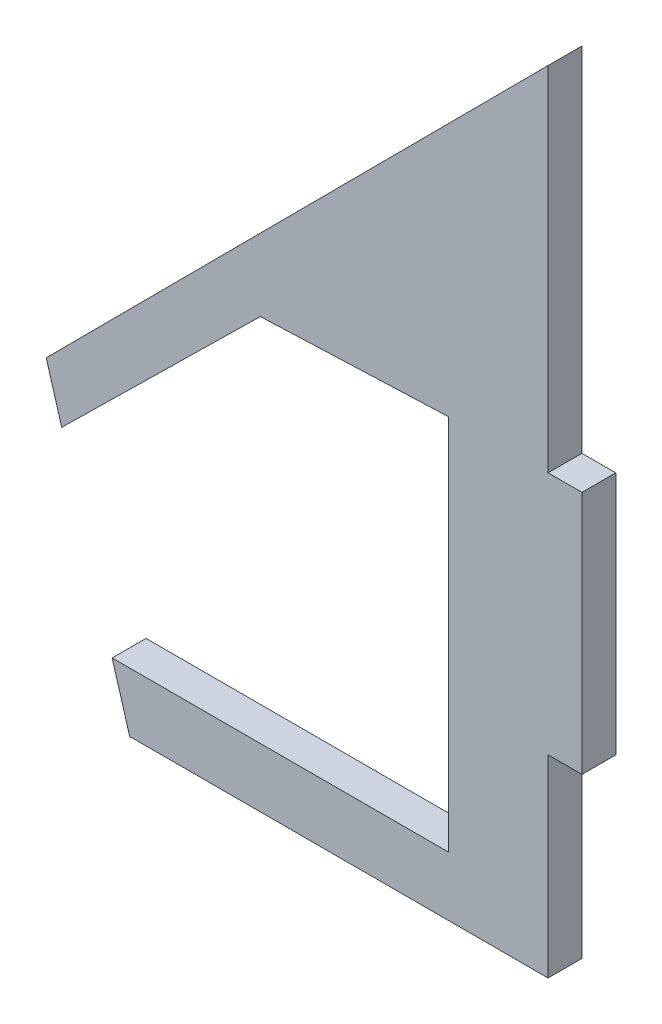
from build123d import *

# Parameters (mm, degrees)
BOSS_EXTRUDE1_DEPTH = 1.524


with BuildPart() as part:
    # Sketch1 → Boss-Extrude1 (new body)
    with BuildSketch(Plane.XY):
        Polygon((-0.895219037, 31.645019131), (-0.895219037, 47.520517489), (-23.482745214, 24.835129324), (-22.785515157, 22.473336945), (-13.845756763, 31.26033865), (-5.376702604, 31.593513777), (-5.376702604, 14.620779626), (-20.514575792, 14.620779626), (-19.727451889, 11.954481441), (-0.895219037, 11.954481441), (-0.895219037, 20.651359585), (0.628780963, 20.651359585), (0.628780963, 31.645019131), align=None)
    extrude(amount=BOSS_EXTRUDE1_DEPTH)


solid = part.part
